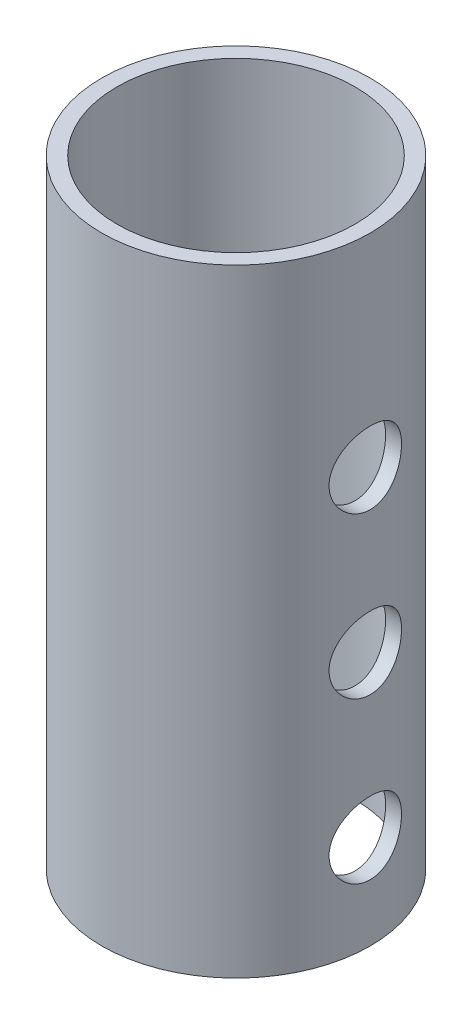
from build123d import *

# Parameters (mm, degrees)
SKETCH1_R           = 42.725
SKETCH1_R_2         = 37.875
BOSS_EXTRUDE1_DEPTH = 196.5
SKETCH2_R           = 11.53
CUT_EXTRUDE1_DEPTH  = 206.57991451
SKETCH4_R           = 7.5
CUT_EXTRUDE2_DEPTH  = 206.579914647


with BuildPart() as part:
    # Sketch1 → Boss-Extrude1 (new body)
    with BuildSketch(Plane(origin=(0, 0, 0), x_dir=(1, 0, 0), z_dir=(0, 1, 0))):
        Circle(SKETCH1_R)
        Circle(SKETCH1_R_2, mode=Mode.SUBTRACT)
    extrude(amount=BOSS_EXTRUDE1_DEPTH)

    # Sketch2 → Cut-Extrude1 (cut, through all)
    with BuildSketch(Plane(origin=(0, 0, 0), x_dir=(0, 0, -1), z_dir=(1, 0, 0))):
        with Locations((0, 131.8)):
            Circle(SKETCH2_R)
        with Locations((0, 80.8)):
            Circle(SKETCH2_R)
        with Locations((0, 29.8)):
            Circle(SKETCH2_R)
    extrude(amount=CUT_EXTRUDE1_DEPTH, mode=Mode.SUBTRACT)

    # Sketch4 → Cut-Extrude2 (cut, through all)
    with BuildSketch(Plane(origin=(0, 0, 0), x_dir=(0, 0, -1), z_dir=(1, 0, 0))):
        with Locations((0, 106.3)):
            Circle(SKETCH4_R)
    extrude(amount=-CUT_EXTRUDE2_DEPTH, mode=Mode.SUBTRACT)


solid = part.part
